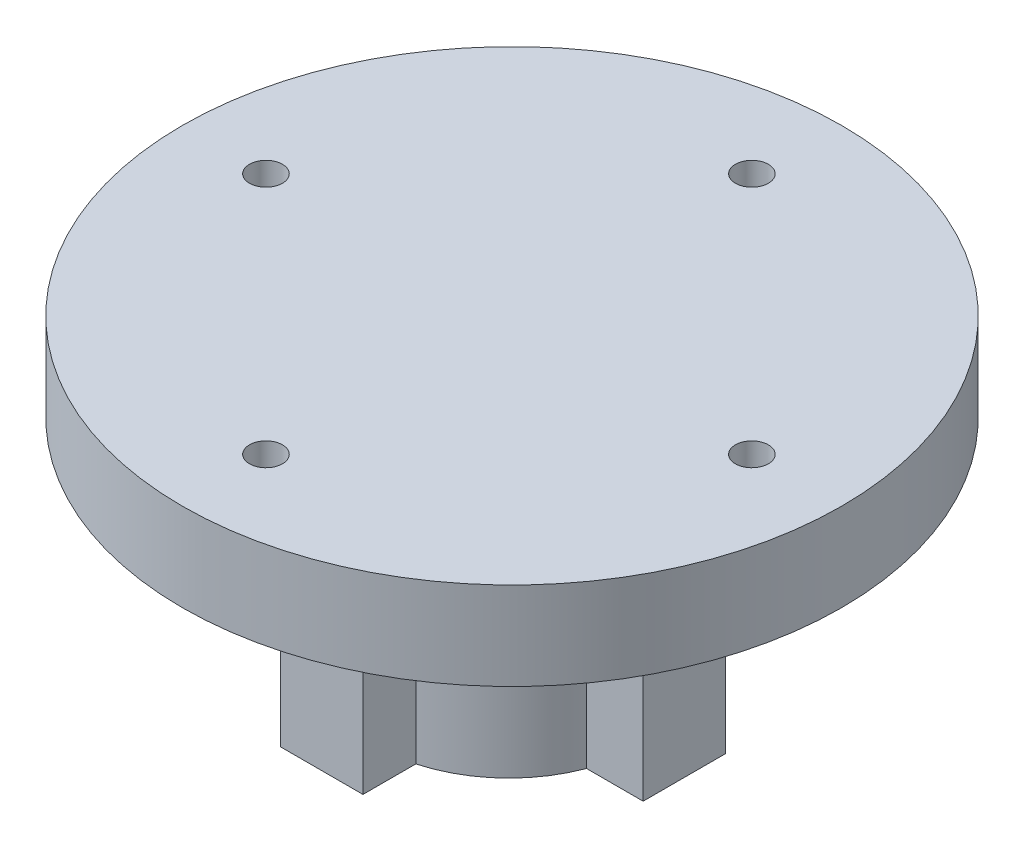
from build123d import *

# Parameters (mm, degrees)
BOSS_EXTRUDE1_DEPTH = 20
SKETCH2_R           = 30
BOSS_EXTRUDE2_DEPTH = 8
SKETCH3_R           = 1.5
CUT_EXTRUDE1_DEPTH  = 12


with BuildPart() as part:
    # Sketch1 → Boss-Extrude1 (new body)
    with BuildSketch(Plane(origin=(0, 0, 0), x_dir=(1, 0, 0), z_dir=(0, 1, 0))):
        with BuildLine():
            Line((16.496787135, 3.216607511), (16.496787135, -4.283392489))
            Line((16.496787135, -4.283392489), (11.343199451, -4.283392489))
            ThreePointArc((11.343199451, -4.283392489), (8.167833643, -8.961144937), (3.216607511, -11.690554355))
            Line((3.216607511, -11.690554355), (3.216607511, -16.496787135))
            Line((3.216607511, -16.496787135), (-4.283392489, -16.496787135))
            Line((-4.283392489, -16.496787135), (-4.283392489, -11.343199451))
            ThreePointArc((-4.283392489, -11.343199451), (-8.961144937, -8.167833643), (-11.690554355, -3.216607511))
            Line((-11.690554355, -3.216607511), (-16.496787135, -3.216607511))
            Line((-16.496787135, -3.216607511), (-16.496787135, 4.283392489))
            Line((-16.496787135, 4.283392489), (-11.343199451, 4.283392489))
            ThreePointArc((-11.343199451, 4.283392489), (-8.167833643, 8.961144937), (-3.216607511, 11.690554355))
            Line((-3.216607511, 11.690554355), (-3.216607511, 16.496787135))
            Line((-3.216607511, 16.496787135), (4.283392489, 16.496787135))
            Line((4.283392489, 16.496787135), (4.283392489, 11.343199451))
            ThreePointArc((4.283392489, 11.343199451), (8.961144937, 8.167833643), (11.690554355, 3.216607511))
            Line((11.690554355, 3.216607511), (16.496787135, 3.216607511))
        make_face()
    extrude(amount=BOSS_EXTRUDE1_DEPTH)

    # Sketch2 → Boss-Extrude2 (add)
    with BuildSketch(Plane(origin=(0, 20, 0), x_dir=(1, 0, 0), z_dir=(0, 1, 0))):
        with Locations((0.279992144, 0)):
            Circle(SKETCH2_R)
    extrude(amount=BOSS_EXTRUDE2_DEPTH)

    # Sketch3 → Cut-Extrude1 (cut)
    with BuildSketch(Plane(origin=(0, 28, 0), x_dir=(1, 0, 0), z_dir=(0, 1, 0))):
        with Locations((0, 22.106714755)):
            Circle(SKETCH3_R)
        with Locations((22.106714755, 0)):
            Circle(SKETCH3_R)
        with Locations((0, -22.106714755)):
            Circle(SKETCH3_R)
        with Locations((-22.106714755, 0)):
            Circle(SKETCH3_R)
    extrude(amount=-CUT_EXTRUDE1_DEPTH, mode=Mode.SUBTRACT)


solid = part.part
